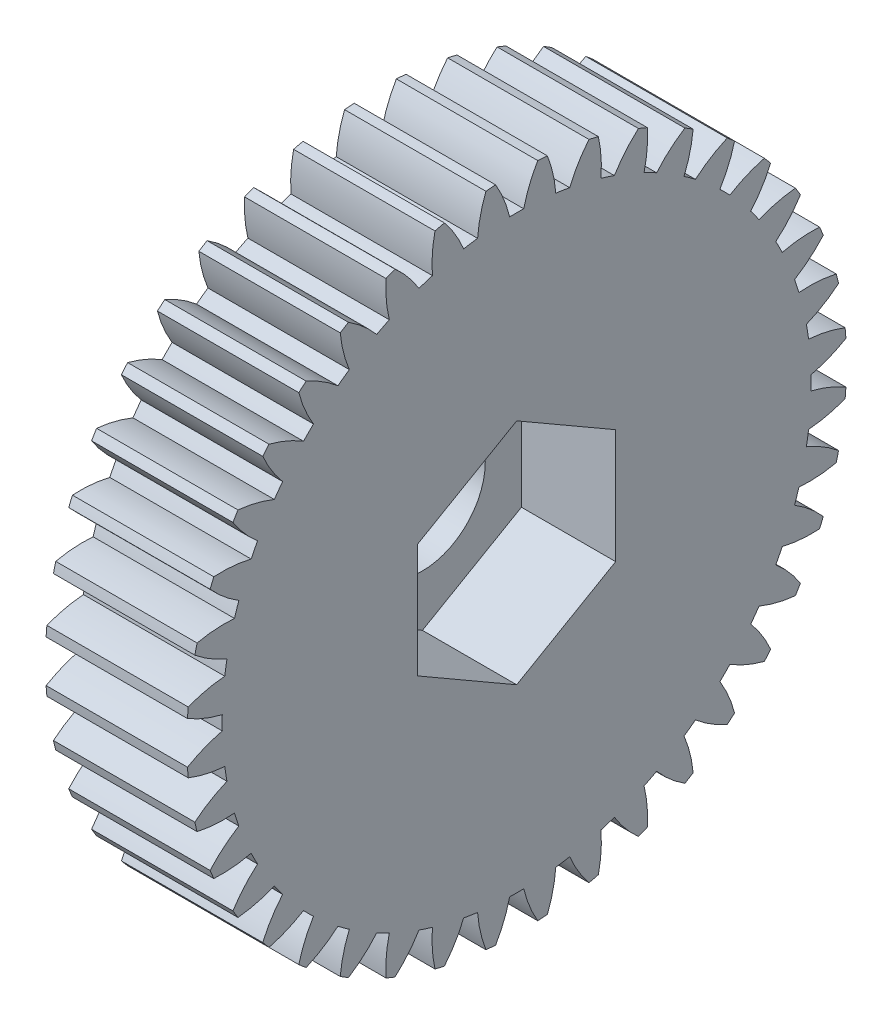
from build123d import *
from build123d.topology import SkipClean

# Parameters (mm, degrees)
BASPROSKE_W         = 9
BASPROSKE_H         = 21
TOOTHCUT_DEPTH      = 32.032241298
TEETHCUTS_COUNT     = 40
TEETHCUTS_ANGLE     = 351
BORSKE_R            = 2
BORE_DEPTH          = 50.0000508
CUT_EXTRUDE1_DEPTH  = 6
SKETCH1_7_R         = 4
CUT_EXTRUDE2_DEPTH  = 31.974304622
SKETCH2_R           = 6
SKETCH2_R_2         = 4
BOSS_EXTRUDE1_DEPTH = 1.8


with BuildPart() as part:
    # BasProSke → Base-Revolve (revolve)
    with BuildSketch(Plane(origin=(0, 0, 0), x_dir=(1, 0, 0), z_dir=(0, 1, 0))):
        with Locations((4.5, 10.5)):
            Rectangle(BASPROSKE_W, BASPROSKE_H)
    revolve(axis=Axis((-10, 0, 0), (1, 0, 0)))

    # TooCutSke → ToothCut (cut, through all)
    with BuildSketch(Plane(origin=(0, 0, 0), x_dir=(0, 0, -1), z_dir=(1, 0, 0))):
        with BuildLine():
            ThreePointArc((0.448673268, 18.74363074), (0, 18.749), (-0.448673268, 18.74363074))
            ThreePointArc((-0.448673268, 18.74363074), (-0.816786816, 19.89705013), (-1.354745081, 20.981708961))
            ThreePointArc((-1.354745081, 20.981708961), (0, 21.0254), (1.354745081, 20.981708961))
            ThreePointArc((1.354745081, 20.981708961), (0.816786816, 19.89705013), (0.448673268, 18.74363074))
        make_face()
    toothcut = extrude(amount=TOOTHCUT_DEPTH, mode=Mode.SUBTRACT)

    # TeethCuts: ToothCut ×40 about axis
    teethcuts_axis = Axis((-10, 0, 0), (1, 0, 0))
    for i in range(1, TEETHCUTS_COUNT):
        add(toothcut.rotate(teethcuts_axis, i * TEETHCUTS_ANGLE / (TEETHCUTS_COUNT - 1)), mode=Mode.SUBTRACT)

    # BorSke → Bore (cut, symmetric)
    with BuildSketch(Plane(origin=(0, 0, 0), x_dir=(0, 0, -1), z_dir=(1, 0, 0))):
        Circle(BORSKE_R)
    extrude(amount=BORE_DEPTH, both=True, mode=Mode.SUBTRACT)

    # Sketch1 → Cut-Extrude1 (cut)
    with BuildSketch(Plane(origin=(9, 0, 0), x_dir=(0, 0, -1), z_dir=(1, 0, 0))):
        Polygon((0, 7.274613392), (-6.3, 3.637306696), (-6.3, -3.637306696), (0, -7.274613392), (6.3, -3.637306696), (6.3, 3.637306696), align=None)
    extrude(amount=-CUT_EXTRUDE1_DEPTH, mode=Mode.SUBTRACT)

    # Sketch1<7> → Cut-Extrude2 (cut, through all)
    with BuildSketch(Plane(origin=(9, 0, 0), x_dir=(0, 0, -1), z_dir=(1, 0, 0))):
        Circle(SKETCH1_7_R)
    extrude(amount=-CUT_EXTRUDE2_DEPTH, mode=Mode.SUBTRACT)

    # Sketch2 → Boss-Extrude1 (add)
    with SkipClean():  # the faces are left unmerged after this step: merging them gives an invalid solid
        with BuildSketch(Plane.ZY):
            Circle(SKETCH2_R)
            Circle(SKETCH2_R_2, mode=Mode.SUBTRACT)
        extrude(amount=BOSS_EXTRUDE1_DEPTH)


solid = part.part
